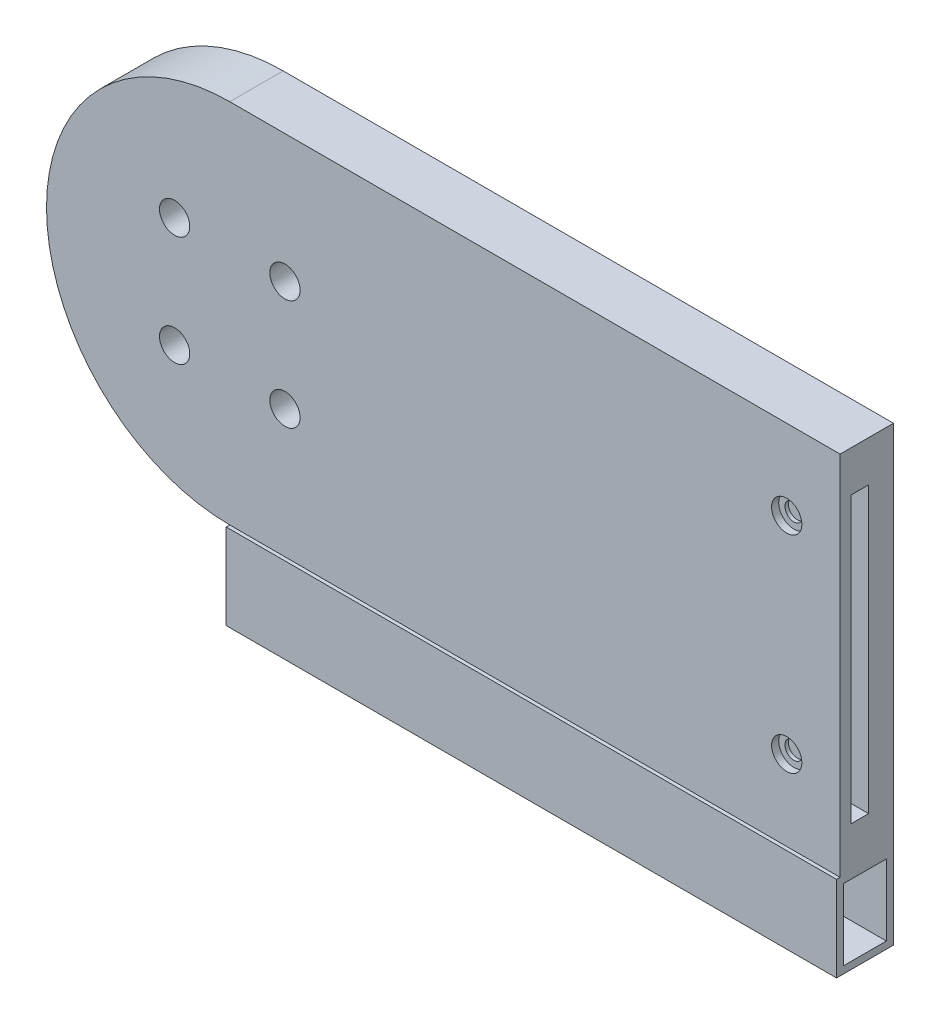
from build123d import *

# Parameters (mm, degrees)
CROQUIS1_W                        = 103
CROQUIS1_H                        = 103
CROQUIS1_R                        = 2.5
SALIENTE_EXTRUIR1_DEPTH           = 15
REDONDEO2_R                       = 51.5
CROQUIS2_W                        = 15
CROQUIS2_H                        = 103
SALIENTE_EXTRUIR2_DEPTH           = 120
CROQUIS3_R                        = 4.25
CORTAR_EXTRUIR1_DEPTH             = 8
SALIENTE_EXTRUIR3_START           = -223
SALIENTE_EXTRUIR3_DEPTH           = 223
CORTAR_EXTRUIR2_DEPTH             = 181.53669987
CORTAR_EXTRUIR2_DEPTH_BACK        = 181.53669987
REDONDEO3_START                   = -23.965772234
REDONDEO3_DEPTH                   = 195.465772234
REDONDEO3_START_2                 = -45.024993159
REDONDEO3_2_DEPTH                 = 21.059220925
REDONDEO3_START_3                 = 15
REDONDEO3_3_DEPTH                 = 9
REDONDEO4_R                       = 10
CORTAR_EXTRUIR3_REACH             = 182.537
CROQUIS6_R                        = 4.25
CORTAR_EXTRUIR3_DIRECTION_2_DEPTH = 181.536699978
CORTAR_EXTRUIR4_DEPTH             = 231.022281636
CORTAR_EXTRUIR4_DEPTH_BACK        = 40
CROQUIS7_W                        = 5
CROQUIS7_H                        = 80
CROQUIS10_R                       = 4.25
CORTAR_EXTRUIR5_DEPTH             = 10
CROQUIS11_R                       = 2.5
CORTAR_EXTRUIR6_DEPTH             = 180.536904387
CROQUIS12_W                       = 16
CROQUIS12_H                       = 24
CROQUIS12_W_2                     = 12
CROQUIS12_H_2                     = 20
SALIENTE_EXTRUIR4_DEPTH           = 171.5
CORTAR_EXTRUIR7_DEPTH             = 4
CROQUIS14_W                       = 242.583484446
CROQUIS14_H                       = 103.867159029
CORTAR_EXTRUIR8_DEPTH             = 8


with BuildPart() as part:
    # Croquis1 → Saliente-Extruir1 (new body)
    with BuildSketch(Plane.XY):
        Rectangle(CROQUIS1_W, CROQUIS1_H)
        with Locations((15.5, 15.5)):
            Circle(CROQUIS1_R, mode=Mode.SUBTRACT)
        with Locations((-15.5, 15.5)):
            Circle(CROQUIS1_R, mode=Mode.SUBTRACT)
        with Locations((-15.5, -15.5)):
            Circle(CROQUIS1_R, mode=Mode.SUBTRACT)
        with Locations((15.5, -15.5)):
            Circle(CROQUIS1_R, mode=Mode.SUBTRACT)
    extrude(amount=SALIENTE_EXTRUIR1_DEPTH)

    # Redondeo2
    redondeo2_edges = [part.edges().sort_by_distance(p)[0] for p in [
        (-51.5, -51.5, 7.5),
        (-51.5, 51.5, 7.5),
    ]]
    fillet(redondeo2_edges, radius=REDONDEO2_R - 0.0001)  # a hair under: the kernel refuses the full size

    # Croquis2 → Saliente-Extruir2 (add)
    with BuildSketch(Plane(origin=(51.5, 0, 0), x_dir=(0, 0, -1), z_dir=(1, 0, 0))):
        with Locations((-7.5, 0)):
            Rectangle(CROQUIS2_W, CROQUIS2_H)
    extrude(amount=SALIENTE_EXTRUIR2_DEPTH)

    # Croquis3 → Cortar-Extruir1 (cut)
    with BuildSketch(Plane.XY.offset(15)):
        with Locations((-15.5, 15.5)):
            Circle(CROQUIS3_R)
        with Locations((15.5, 15.5)):
            Circle(CROQUIS3_R)
        with Locations((15.5, -15.5)):
            Circle(CROQUIS3_R)
        with Locations((-15.5, -15.5)):
            Circle(CROQUIS3_R)
    extrude(amount=-CORTAR_EXTRUIR1_DEPTH, mode=Mode.SUBTRACT)

    # Croquis4 → Saliente-Extruir3 (add)
    with BuildSketch(Plane(origin=(171.5, 0, 0), x_dir=(0, 0, -1), z_dir=(1, 0, 0)).offset(SALIENTE_EXTRUIR3_START)):
        Polygon((-15, -19), (-15, -25), (-23, -25), (-23, 25), (-15, 25), (-15, 19), (-19, 19), (-19, -19), align=None)
    extrude(amount=SALIENTE_EXTRUIR3_DEPTH)

    # Croquis5 → Cortar-Extruir2 (cut, two sides: drawn at the far end of the back side and taken through both)
    with BuildSketch(Plane(origin=(0, 0, 0), x_dir=(-1, 0, 0), z_dir=(0, 0, -1)).offset(-CORTAR_EXTRUIR2_DEPTH_BACK)):
        with BuildLine():
            Line((40.930864284, 31.255629077), (61.422564692, 30.315306135))
            Line((61.422564692, 30.315306135), (63.075048064, -35.056936027))
            Line((63.075048064, -35.056936027), (38.432028807, -34.281615507))
            ThreePointArc((38.432028807, -34.281615507), (48.122237498, -18.343943366), (51.5, 0))
            ThreePointArc((51.5, 0), (48.786214808, 16.497128377), (40.930864284, 31.255629077))
        make_face()
    extrude(amount=CORTAR_EXTRUIR2_DEPTH + CORTAR_EXTRUIR2_DEPTH_BACK, mode=Mode.SUBTRACT)

    # Redondeo3: read off the stored shape, not the designer's step
    # Redondeo3 outline → Redondeo3 (add)
    with BuildSketch(Plane.YZ.offset(REDONDEO3_START)):
        with BuildLine():
            Line((-25, 15), (-25, 23))
            ThreePointArc((-25, 23), (-28.473403651, 17.254033308), (-34.797958971, 15))
            Line((-34.797958971, 15), (-25, 15))
        make_face()
        with BuildLine():
            ThreePointArc((34.797958971, 15), (28.473403651, 17.254033308), (25, 23))
            Line((25, 23), (25, 15))
            Line((25, 15), (34.797958971, 15))
        make_face()
    extrude(amount=REDONDEO3_DEPTH)

    # Redondeo3 2 outline → Redondeo3 2 (add)
    with BuildSketch(Plane.YZ.offset(REDONDEO3_START_2)):
        with BuildLine():
            ThreePointArc((34.797958971, 15), (28.473403651, 17.254033308), (25, 23))
            Line((25, 23), (25, 15))
            Line((25, 15), (34.797958971, 15))
        make_face()
        with BuildLine():
            Line((-25, 15), (-25, 23))
            ThreePointArc((-25, 23), (-28.473403651, 17.254033308), (-34.797958971, 15))
            Line((-34.797958971, 15), (-25, 15))
        make_face()
    extrude(amount=REDONDEO3_2_DEPTH)

    # Redondeo3 3 outline → Redondeo3 3 (cut)
    with BuildSketch(Plane.XY.offset(REDONDEO3_START_3)):
        with BuildLine():
            Line((-45.024993159, -36), (-36.827299657, -36))
            ThreePointArc((-36.827299657, -36), (-41.294060795, -30.774186311), (-45.024993083, -24.999999958))
            Line((-45.024993083, -24.999999958), (-45.024993159, -36))
        make_face()
        with BuildLine():
            Line((-45.024993159, 36), (-45.024993083, 24.999999958))
            ThreePointArc((-45.024993083, 24.999999958), (-41.294060795, 30.774186311), (-36.827299657, 36))
            Line((-36.827299657, 36), (-45.024993159, 36))
        make_face()
    extrude(amount=REDONDEO3_3_DEPTH, mode=Mode.SUBTRACT)

    # Redondeo4
    redondeo4_edges = [part.edges().sort_by_distance(p)[0] for p in [
        (63.237503445, -25, 23),
        (63.237503445, 25, 23),
    ]]
    fillet(redondeo4_edges, radius=REDONDEO4_R)

    # Croquis6 → Cortar-Extruir3 (cut, up to next)
    with BuildSketch(Plane.XY.offset(23), mode=Mode.PRIVATE) as cortar_extruir3_sk1:
        with Locations((15.5, 15.5)):
            Circle(CROQUIS6_R)
    cortar_extruir3_tool1 = extrude(cortar_extruir3_sk1.sketch, amount=-CORTAR_EXTRUIR3_REACH, mode=Mode.PRIVATE) & part.part
    # Croquis6 → Cortar-Extruir3 (cut, up to next)
    with BuildSketch(Plane.XY.offset(23), mode=Mode.PRIVATE) as cortar_extruir3_sk2:
        with Locations((-15.5, 15.5)):
            Circle(CROQUIS6_R)
    cortar_extruir3_tool2 = extrude(cortar_extruir3_sk2.sketch, amount=-CORTAR_EXTRUIR3_REACH, mode=Mode.PRIVATE) & part.part
    # Croquis6 → Cortar-Extruir3 (cut, up to next)
    with BuildSketch(Plane.XY.offset(23), mode=Mode.PRIVATE) as cortar_extruir3_sk3:
        with Locations((15.5, -15.5)):
            Circle(CROQUIS6_R)
    cortar_extruir3_tool3 = extrude(cortar_extruir3_sk3.sketch, amount=-CORTAR_EXTRUIR3_REACH, mode=Mode.PRIVATE) & part.part
    # Croquis6 → Cortar-Extruir3 (cut, up to next)
    with BuildSketch(Plane.XY.offset(23), mode=Mode.PRIVATE) as cortar_extruir3_sk4:
        with Locations((-15.5, -15.5)):
            Circle(CROQUIS6_R)
    cortar_extruir3_tool4 = extrude(cortar_extruir3_sk4.sketch, amount=-CORTAR_EXTRUIR3_REACH, mode=Mode.PRIVATE) & part.part
    add(cortar_extruir3_tool1.solids().sort_by_distance((15.5, 15.5, 23))[0], mode=Mode.SUBTRACT)
    add(cortar_extruir3_tool2.solids().sort_by_distance((-15.5, 15.5, 23))[0], mode=Mode.SUBTRACT)
    add(cortar_extruir3_tool3.solids().sort_by_distance((15.5, -15.5, 23))[0], mode=Mode.SUBTRACT)
    add(cortar_extruir3_tool4.solids().sort_by_distance((-15.5, -15.5, 23))[0], mode=Mode.SUBTRACT)

    # Croquis6 → Cortar-Extruir3 direction 2 (cut)
    with BuildSketch(Plane.XY.offset(23)):
        with Locations((15.5, 15.5)):
            Circle(CROQUIS6_R)
        with Locations((-15.5, 15.5)):
            Circle(CROQUIS6_R)
        with Locations((15.5, -15.5)):
            Circle(CROQUIS6_R)
        with Locations((-15.5, -15.5)):
            Circle(CROQUIS6_R)
    extrude(amount=CORTAR_EXTRUIR3_DIRECTION_2_DEPTH, mode=Mode.SUBTRACT)

    # Croquis7 → Cortar-Extruir4 (cut, two sides: drawn at the far end of the back side and taken through both)
    with BuildSketch(Plane(origin=(171.5, 0, 0), x_dir=(0, 0, -1), z_dir=(1, 0, 0)).offset(-CORTAR_EXTRUIR4_DEPTH_BACK)):
        with Locations((-9.5, 0)):
            Rectangle(CROQUIS7_W, CROQUIS7_H)
    extrude(amount=CORTAR_EXTRUIR4_DEPTH + CORTAR_EXTRUIR4_DEPTH_BACK, mode=Mode.SUBTRACT)

    # Croquis10 → Cortar-Extruir5 (cut)
    with BuildSketch(Plane.XY.offset(23)):
        with Locations((156.5, 29)):
            Circle(CROQUIS10_R)
        with Locations(Location((156.5, -29, 0), (0, 0, 31.206732466))):
            Circle(CROQUIS10_R)
    extrude(amount=-CORTAR_EXTRUIR5_DEPTH, mode=Mode.SUBTRACT)

    # Croquis11 → Cortar-Extruir6 (cut, through all)
    with BuildSketch(Plane.XY.offset(13)):
        with Locations((156.5, 29)):
            Circle(CROQUIS11_R)
        with Locations((156.5, -29)):
            Circle(CROQUIS11_R)
    extrude(amount=-CORTAR_EXTRUIR6_DEPTH, mode=Mode.SUBTRACT)

    # Croquis12 → Saliente-Extruir4 (add)
    with BuildSketch(Plane(origin=(171.5, 0, 0), x_dir=(0, 0, -1), z_dir=(1, 0, 0))):
        with Locations((-8, -63.5)):
            Rectangle(CROQUIS12_W, CROQUIS12_H)
        with Locations((-8, -63.5)):
            Rectangle(CROQUIS12_W_2, CROQUIS12_H_2, mode=Mode.SUBTRACT)
    extrude(amount=-SALIENTE_EXTRUIR4_DEPTH)

    # Croquis13 → Cortar-Extruir7 (cut)
    with BuildSketch(Plane(origin=(0, 0, 0), x_dir=(-1, 0, 0), z_dir=(0, 0, -1))):
        Polygon((-156.5, 24.381197846), (-152.5, 26.690598923), (-152.5, 31.309401077), (-156.5, 33.618802154), (-160.5, 31.309401077), (-160.5, 26.690598923), align=None)
        Polygon((-152.5, -26.690598923), (-156.5, -24.381197846), (-160.5, -26.690598923), (-160.5, -31.309401077), (-156.5, -33.618802154), (-152.5, -31.309401077), align=None)
    extrude(amount=-CORTAR_EXTRUIR7_DEPTH, mode=Mode.SUBTRACT)

    # Croquis14 → Cortar-Extruir8 (cut)
    with BuildSketch(Plane.XY.offset(23)):
        with Locations((50.208257777, 0.433579514)):
            Rectangle(CROQUIS14_W, CROQUIS14_H)
    extrude(amount=-CORTAR_EXTRUIR8_DEPTH, mode=Mode.SUBTRACT)


solid = part.part
